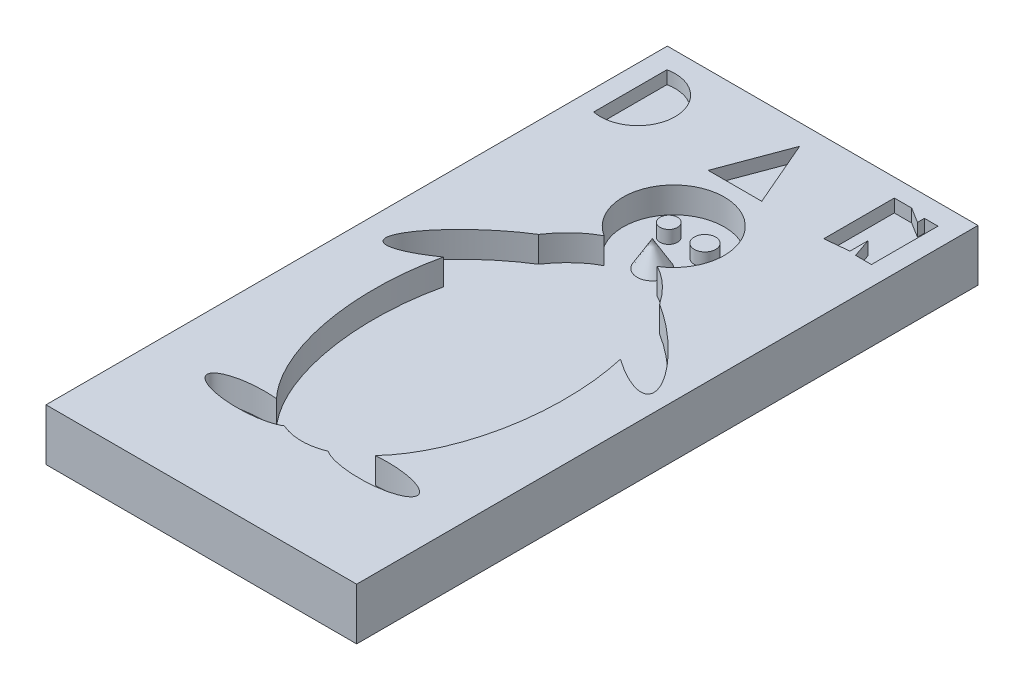
from build123d import *

# Parameters (mm, degrees)
SKETCH1_W           = 76.2
SKETCH1_H           = 152.4
BOSS_EXTRUDE1_DEPTH = 12.7
CUT_EXTRUDE1_DEPTH  = 6.35
SKETCH4_R           = 3.744796995
SKETCH6_R           = 2.147744767
SKETCH6_R_2         = 2.625021382
BOSS_EXTRUDE2_DEPTH = 3.175
CUT_EXTRUDE2_DEPTH  = 3.175


with BuildPart() as part:
    # Sketch1 → Boss-Extrude1 (new body)
    with BuildSketch(Plane(origin=(0, 0, 0), x_dir=(1, 0, 0), z_dir=(0, 1, 0))):
        with Locations((38.1, 76.2)):
            Rectangle(SKETCH1_W, SKETCH1_H)
    extrude(amount=BOSS_EXTRUDE1_DEPTH)

    # Sketch2 → Cut-Extrude1 (cut)
    with BuildSketch(Plane(origin=(0, 12.7, 0), x_dir=(1, 0, 0), z_dir=(0, 1, 0))):
        with BuildLine():
            ThreePointArc((45.554326982, 104.348304437), (39.05455323, 127.328257367), (32.554779478, 104.348304437))
            add(Edge.make_bspline(
                [(32.554779478, 104.348304437), (27.923198079, 101.989560165), (24.199309944, 96.598646365)],
                knots=[0.281636254, 0.281636254, 0.281636254, 0.688273207, 0.688273207, 0.688273207], degree=2, weights=[1, 0.979401903, 1]))
            add(Edge.make_bspline(
                [(24.199309944, 96.598646365), (10.401370614, 88.094838529), (6.623541816, 79.011124554), (2.845713018, 69.927410579), (17.347642511, 80.123948717)],
                knots=[4.137576805, 4.137576805, 4.137576805, 5.801682385, 5.801682385, 7.465787964, 7.465787964, 7.465787964], degree=2, weights=[1, 0.673359521, 1, 0.673359521, 1]))
            add(Edge.make_bspline(
                [(17.347642511, 80.123948717), (9.961238095, 47.695305578), (26.938646337, 29.594967579)],
                knots=[1.189489458, 1.189489458, 1.189489458, 2.596997927, 2.596997927, 2.596997927], degree=2, weights=[1, 0.762418259, 1]))
            add(Edge.make_bspline(
                [(26.938646337, 29.594967579), (4.843164164, 31.605433742), (14.217513543, 24.852116093), (23.591862921, 18.098798445), (33.669344885, 24.74614624)],
                knots=[4.437172344, 4.437172344, 4.437172344, 6.70377495, 6.70377495, 8.970377555, 8.970377555, 8.970377555], degree=2, weights=[1, 0.42367175, 1, 0.42367175, 1]))
            add(Edge.make_bspline(
                [(33.669344885, 24.74614624), (39.05455323, 22.503130488), (44.439761574, 24.74614624)],
                knots=[2.909238116, 2.909238116, 2.909238116, 3.373947191, 3.373947191, 3.373947191], degree=2, weights=[1, 0.973126915, 1]))
            add(Edge.make_bspline(
                [(44.439761574, 24.74614624), (54.517243538, 18.098798445), (63.891592917, 24.852116093), (73.265942295, 31.605433742), (51.170460123, 29.594967579)],
                knots=[3.595993059, 3.595993059, 3.595993059, 5.862595664, 5.862595664, 8.12919827, 8.12919827, 8.12919827], degree=2, weights=[1, 0.42367175, 1, 0.42367175, 1]))
            add(Edge.make_bspline(
                [(51.170460123, 29.594967579), (68.147868364, 47.695305578), (60.761463949, 80.123948717)],
                knots=[3.68618738, 3.68618738, 3.68618738, 5.09369585, 5.09369585, 5.09369585], degree=2, weights=[1, 0.762418259, 1]))
            add(Edge.make_bspline(
                [(60.761463949, 80.123948717), (75.263393441, 69.927410579), (71.485564643, 79.011124554), (67.707735845, 88.094838529), (53.909796516, 96.598646365)],
                knots=[5.10058265, 5.10058265, 5.10058265, 6.76468823, 6.76468823, 8.428793809, 8.428793809, 8.428793809], degree=2, weights=[1, 0.673359521, 1, 0.673359521, 1]))
            add(Edge.make_bspline(
                [(53.909796516, 96.598646365), (50.185908381, 101.989560165), (45.554326982, 104.348304437)],
                knots=[5.5949121, 5.5949121, 5.5949121, 6.001549053, 6.001549053, 6.001549053], degree=2, weights=[1, 0.979401903, 1]))
        make_face()
    extrude(amount=-CUT_EXTRUDE1_DEPTH, mode=Mode.SUBTRACT)

    # Sketch4 → Loft1 section 0
    with BuildSketch(Plane(origin=(0, 6.35, 0), x_dir=(1, 0, 0), z_dir=(0, 1, 0)), mode=Mode.PRIVATE) as loft1_s0:
        with Locations((39.05455323, 109.669022617)):
            Circle(SKETCH4_R)
    loft([loft1_s0.sketch, Vertex(39.05455323, 12.7, -109.669022617)])

    # Sketch6 → Boss-Extrude2 (add)
    with BuildSketch(Plane(origin=(0, 6.35, 0), x_dir=(1, 0, 0), z_dir=(0, 1, 0))):
        with Locations((34.445133471, 118.313867451)):
            Circle(SKETCH6_R)
        with Locations((43.313181821, 118.313867451)):
            Circle(SKETCH6_R_2)
    extrude(amount=BOSS_EXTRUDE2_DEPTH)

    # Sketch7 → Cut-Extrude2 (cut)
    with BuildSketch(Plane(origin=(0, 12.7, 0), x_dir=(1, 0, 0), z_dir=(0, 1, 0))):
        Polygon((31.415995896, 131.008717746), (37.515244229, 147.337843698), (44.550696836, 131.008717746), (41.032970532, 131.008717746), (33.902166631, 131.008717746), align=None)
        with BuildLine():
            Line((4.975149077, 147.330196681), (4.975149077, 129.360621))
            ThreePointArc((4.975149077, 129.360621), (15.965075031, 138.345408841), (4.975149077, 147.330196681))
        make_face()
        Polygon((65.949770063, 131.229413086), (65.949770063, 135.702678285), (67.541790758, 131.030241117), (71.441389338, 131.008717746), (71.441389338, 147.337843698), (68.116741502, 147.337843698), (68.116741502, 145.642054802), (66.966840014, 146.353252882), (64.368883425, 147.960052906), (60.113372227, 147.960052906), (60.113372227, 130.65394574), align=None)
    extrude(amount=-CUT_EXTRUDE2_DEPTH, mode=Mode.SUBTRACT)


solid = part.part
